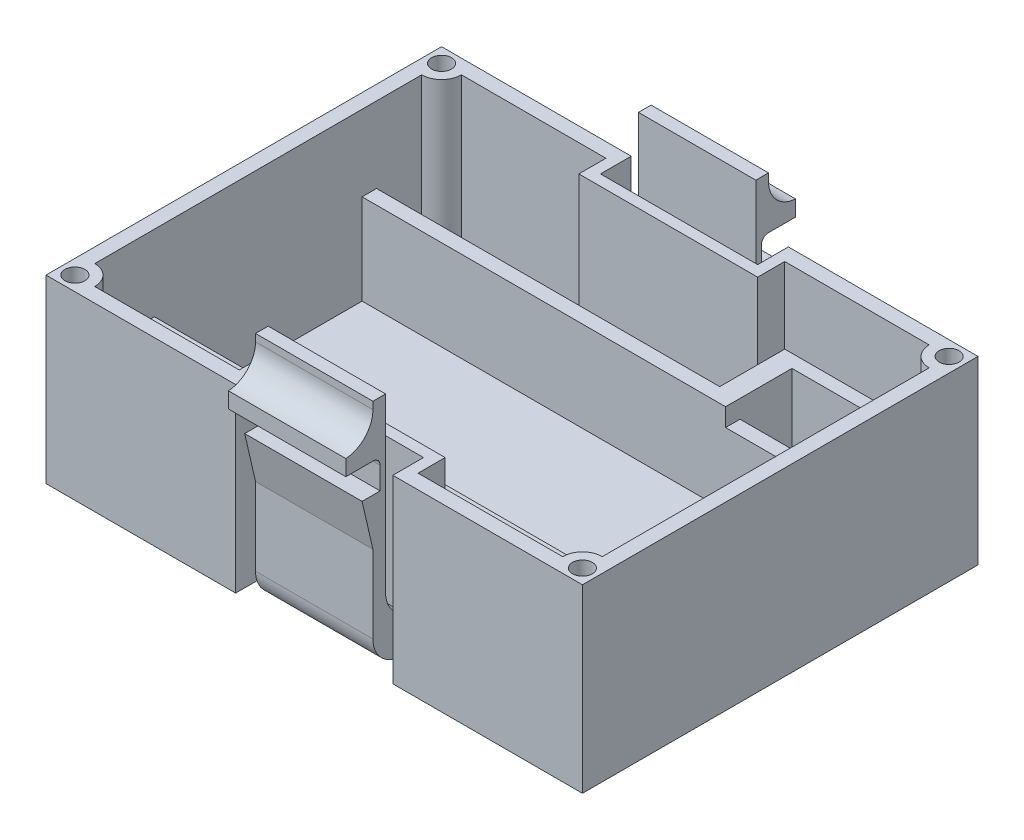
from build123d import *
from build123d.topology import SkipClean

# Parameters (mm, degrees)
BOSS_EXTRUDE1_DEPTH   = 20
CUT_EXTRUDE1_DEPTH    = 18.4
SKETCH3_W             = 14.5
SKETCH3_H             = 2.85
CUT_EXTRUDE2_DEPTH    = 18.4
SKETCH4_W             = 13
SKETCH4_H             = 1.4
BOSS_EXTRUDE2_DEPTH   = 22
BOSS_EXTRUDE2_2_DEPTH = 22
SKETCH5_W             = 13
SKETCH5_H             = 3.4
BOSS_EXTRUDE3_DEPTH   = 4
FILLET1_R             = 3.2
FILLET2_R             = 3.2
BOSS_EXTRUDE4_DEPTH   = 13
SKETCH8_W             = 0.8
SKETCH8_H             = 3.26
CUT_EXTRUDE3_DEPTH    = 13
FILLET3_R             = 3.2
FILLET4_R             = 0.8
SKETCH9_W             = 56.2
SKETCH9_H             = 1.6
BOSS_EXTRUDE5_DEPTH   = 10
SKETCH13_W            = 15.95
SKETCH13_H            = 1.6
CUT_EXTRUDE6_DEPTH    = 2
BOSS_EXTRUDE6_DEPTH   = 18.4
CUT_EXTRUDE5_START    = -18.4
SKETCH12_R            = 1.1
CUT_EXTRUDE5_DEPTH    = 18.4
SKETCH14_W            = 15.95
SKETCH14_H            = 5.75
CUT_EXTRUDE7_DEPTH    = 10


with BuildPart() as part:
    # Sketch1 → Boss-Extrude1 (new body)
    with BuildSketch(Plane(origin=(0, 0, 0), x_dir=(1, 0, 0), z_dir=(0, 1, 0))):
        Polygon((-38.4, 43.8), (-38.4, 40.4), (-21, 40.4), (-21, 43.8), (0, 43.8), (0, 0), (-21, 0), (-21, 3.4), (-38.4, 3.4), (-38.4, 0), (-59.4, 0), (-59.4, 43.8), align=None)
    extrude(amount=BOSS_EXTRUDE1_DEPTH)

    # Sketch2 → Cut-Extrude1 (cut)
    with BuildSketch(Plane(origin=(0, 20, 0), x_dir=(1, 0, 0), z_dir=(0, 1, 0))):
        Polygon((-57.8, 42.2), (-39.6, 42.2), (-39.6, 39.2), (-19.8, 39.2), (-19.8, 42.2), (-1.6, 42.2), (-1.6, 1.6), (-19.8, 1.6), (-19.8, 4.6), (-39.6, 4.6), (-39.6, 1.6), (-57.8, 1.6), align=None)
    extrude(amount=-CUT_EXTRUDE1_DEPTH, mode=Mode.SUBTRACT)

    # Sketch3 → Cut-Extrude2 (cut)
    with BuildSketch(Plane(origin=(0, 1.6, 0), x_dir=(1, 0, 0), z_dir=(0, 1, 0))):
        with Locations((-8.85, 37.875)):
            Rectangle(SKETCH3_W, SKETCH3_H)
    extrude(amount=-CUT_EXTRUDE2_DEPTH, mode=Mode.SUBTRACT)



with BuildPart() as body_2:
    # Sketch4 → Boss-Extrude2 (new body)
    with BuildSketch(Plane.XZ):
        with Locations((-29.7, -0.7)):
            Rectangle(SKETCH4_W, SKETCH4_H)
    extrude(amount=-BOSS_EXTRUDE2_DEPTH)


with BuildPart() as body_3:
    # Sketch4 → Boss-Extrude2 2 (new body)
    with BuildSketch(Plane.XZ):
        with Locations((-29.7, -43.1)):
            Rectangle(SKETCH4_W, SKETCH4_H)
    extrude(amount=-BOSS_EXTRUDE2_2_DEPTH)


with BuildPart() as part_1:
    add(part.part)

    add(body_2.part)  # Boss-Extrude3 merges body 2

    add(body_3.part)  # Boss-Extrude3 merges body 3
    # Sketch5 → Boss-Extrude3 (add)
    with BuildSketch(Plane(origin=(0, 0, 0), x_dir=(-1, 0, 0), z_dir=(0, -1, 0))):
        with Locations((29.7, 1.7)):
            Rectangle(SKETCH5_W, SKETCH5_H)
        with Locations((29.7, 42.1)):
            Rectangle(SKETCH5_W, SKETCH5_H)
    extrude(amount=-BOSS_EXTRUDE3_DEPTH)

    # Fillet1
    fillet1_edges = [part_1.edges().sort_by_distance(p)[0] for p in [
        (-29.7, 0, -43.8),
        (-29.7, 0, 0),
    ]]
    fillet(fillet1_edges, radius=FILLET1_R)

    # Fillet2
    # the kernel refuses this fillet: 3.2 mm, written as the material it adds along each edge
    with BuildSketch(Plane(origin=(-36.2, 4, -1.4), x_dir=(0, 0, -1), z_dir=(1, 0, 0)), Plane(origin=(-23.2, 4, -42.4), x_dir=(0, 0, 1), z_dir=(-1, 0, 0))) as fillet2_piece_1:
        with BuildLine():
            CenterArc((3.2, 2.966479395), FILLET2_R, 180, 67.975687163)
            Line((0, 2.966479395), (-0.064, 2.966479395))
            Line((-0.064, 2.966479395), (-0.064, 0))
            Line((-0.064, 0), (0, -0.064))
            ThreePointArc((0, -0.064), (1, -0.064), (1.976, -0.059329588))
            Line((1.976, -0.059329588), (2, 0))
        make_face()
    extrude(amount=13)

    # Sketch7 → Boss-Extrude4 (add)
    with BuildSketch(Plane(origin=(-23.2, 0, 0), x_dir=(0, 0, -1), z_dir=(1, 0, 0))):
        Polygon((-1.2, 17), (0, 17), (0, 11.8), align=None)
        Polygon((43.8, 11.8), (43.8, 17), (45, 17), align=None)
        Polygon((0, 22), (-3, 22), (-3, 20.26), (1.4, 20.26), (1.4, 22), (1.4, 26), (0, 26), align=None)
        Polygon((43.8, 22), (46.8, 22), (46.8, 20.26), (42.4, 20.26), (42.4, 22), (42.4, 26), (43.8, 26), align=None)
    extrude(amount=-BOSS_EXTRUDE4_DEPTH)

    # Sketch8 → Cut-Extrude3 (cut)
    with BuildSketch(Plane(origin=(-23.2, 0, 0), x_dir=(0, 0, -1), z_dir=(1, 0, 0))):
        with Locations((0.4, 18.63)):
            Rectangle(SKETCH8_W, SKETCH8_H)
        with Locations((43.4, 18.63)):
            Rectangle(SKETCH8_W, SKETCH8_H)
    extrude(amount=-CUT_EXTRUDE3_DEPTH, mode=Mode.SUBTRACT)

    # Fillet3
    # the kernel refuses this fillet: 3.2 mm, written as the material it adds along each edge
    with BuildSketch(Plane(origin=(-36.2, 22, 0), x_dir=(0, 1, 0), z_dir=(1, 0, 0)), Plane(origin=(-23.2, 22, -43.8), x_dir=(0, 1, 0), z_dir=(-1, 0, 0))) as fillet3_piece_1:
        with BuildLine():
            CenterArc((3.193743885, 3.2), FILLET3_R, 183.583321698, 86.416678302)
            Line((0, 3), (-0.063874878, 2.996))
            ThreePointArc((-0.063874878, 2.996), (-0.064, 1.5), (-0.064, 0))
            Line((-0.064, 0), (0, -0.064))
            Line((0, -0.064), (3.193743885, -0.064))
            Line((3.193743885, -0.064), (3.193743885, 0))
        make_face()
    extrude(amount=13)

    # Fillet4
    fillet4_edges = [part_1.edges().sort_by_distance(p)[0] for p in [
        (-29.7, 20.26, -0.8),
        (-29.7, 20.26, -43),
    ]]
    fillet(fillet4_edges, radius=FILLET4_R)

    # Sketch9 → Boss-Extrude5 (add)
    with BuildSketch(Plane(origin=(0, 1.6, 0), x_dir=(1, 0, 0), z_dir=(0, 1, 0))):
        Polygon((-57.8, 35), (-19.8, 35), (-19.8, 39.2), (-19.8, 42.2), (-1.6, 42.2), (-1.6, 40.75), (-17.55, 40.75), (-17.55, 35), (-1.6, 35), (-1.6, 33.4), (-57.8, 33.4), align=None)
        with Locations((-29.7, 9.6)):
            Rectangle(SKETCH9_W, SKETCH9_H)
    extrude(amount=BOSS_EXTRUDE5_DEPTH)

    # Sketch13 → Cut-Extrude6 (cut)
    with BuildSketch(Plane(origin=(0, 11.6, 0), x_dir=(1, 0, 0), z_dir=(0, 1, 0))):
        with Locations((-9.575, 34.2)):
            Rectangle(SKETCH13_W, SKETCH13_H)
    extrude(amount=-CUT_EXTRUDE6_DEPTH, mode=Mode.SUBTRACT)

    # Sketch11 → Boss-Extrude6 (add)
    with BuildSketch(Plane(origin=(0, 1.6, 0), x_dir=(1, 0, 0), z_dir=(0, 1, 0))):
        with BuildLine():
            Line((-57.8, 41.1), (-57.8, 40))
            ThreePointArc((-57.8, 40), (-56.244365081, 40.644365081), (-55.6, 42.2))
            Line((-55.6, 42.2), (-56.7, 42.2))
            ThreePointArc((-56.7, 42.2), (-57.022182541, 41.422182541), (-57.8, 41.1))
        make_face()
        with BuildLine():
            Line((-56.7, 1.6), (-55.6, 1.6))
            ThreePointArc((-55.6, 1.6), (-56.244365081, 3.155634919), (-57.8, 3.8))
            Line((-57.8, 3.8), (-57.8, 2.7))
            ThreePointArc((-57.8, 2.7), (-57.022182541, 2.377817459), (-56.7, 1.6))
        make_face()
        with BuildLine():
            Line((-1.6, 40), (-1.6, 41.1))
            ThreePointArc((-1.6, 41.1), (-2.377817459, 41.422182541), (-2.7, 42.2))
            Line((-2.7, 42.2), (-3.8, 42.2))
            ThreePointArc((-3.8, 42.2), (-3.155634919, 40.644365081), (-1.6, 40))
        make_face()
        with BuildLine():
            ThreePointArc((-1.6, 3.8), (-3.155634919, 3.155634919), (-3.8, 1.6))
            Line((-3.8, 1.6), (-1.6, 1.6))
            Line((-1.6, 1.6), (-1.6, 3.8))
        make_face()
    extrude(amount=BOSS_EXTRUDE6_DEPTH)

    # Sketch12 → Cut-Extrude5 (cut)
    with SkipClean():  # the faces are left unmerged after this step: merging them gives an invalid solid
        with BuildSketch(Plane(origin=(0, 20, 0), x_dir=(1, 0, 0), z_dir=(0, 1, 0)).offset(CUT_EXTRUDE5_START)):
            with Locations(Location((-57.8, 42.2, 0), (0, 0, 270))):
                Circle(SKETCH12_R)
            with Locations(Location((-57.8, 1.6, 0), (0, 0, 270))):
                Circle(SKETCH12_R)
            with Locations(Location((-1.6, 1.6, 0), (0, 0, 270))):
                Circle(SKETCH12_R)
            with Locations(Location((-1.6, 42.2, 0), (0, 0, 270))):
                Circle(SKETCH12_R)
        extrude(amount=CUT_EXTRUDE5_DEPTH, mode=Mode.SUBTRACT)

    # Sketch14 → Cut-Extrude7 (cut)
    with SkipClean():  # the faces are left unmerged after this step: merging them gives an invalid solid
        with BuildSketch(Plane(origin=(0, 1.6, 0), x_dir=(1, 0, 0), z_dir=(0, 1, 0))):
            with Locations((-9.575, 37.875)):
                Rectangle(SKETCH14_W, SKETCH14_H)
        extrude(amount=CUT_EXTRUDE7_DEPTH, mode=Mode.SUBTRACT)


solid = part_1.part
